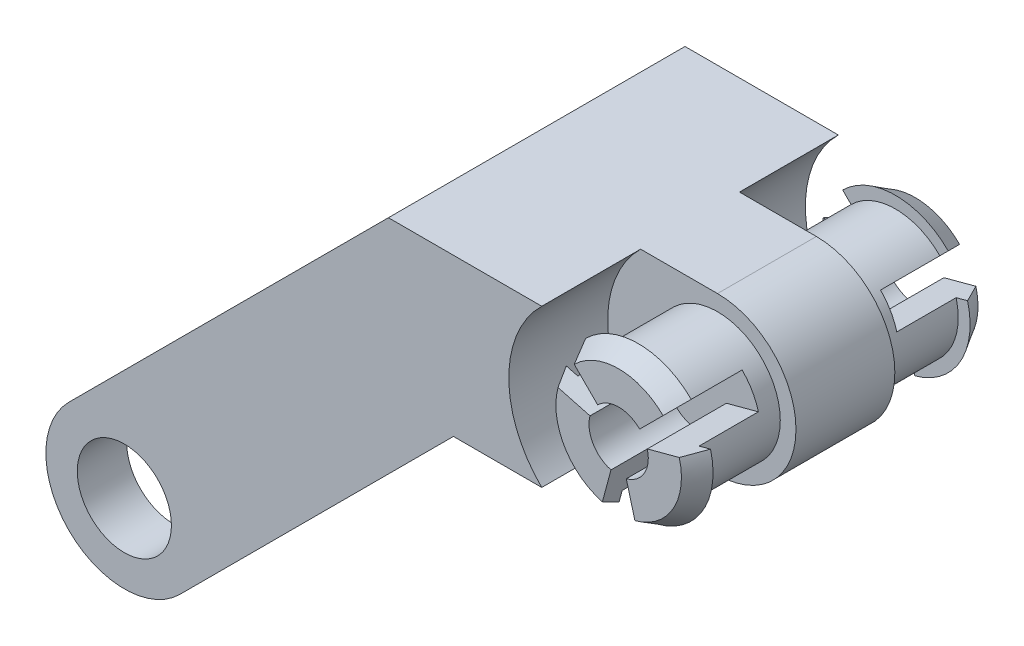
from build123d import *

# Parameters (mm, degrees)
SALIENTE_EXTRUIR1_DEPTH = 7.5
CROQUIS2_W              = 2.5
CROQUIS2_H              = 3.96875
CORTAR_EXTRUIR1_DEPTH   = 15
CROQUIS4_R              = 2.38125
CORTAR_EXTRUIR2_DEPTH   = 15
CROQUIS5_R              = 5.55625
CORTAR_EXTRUIR3_DEPTH   = 5
CORTAR_EXTRUIR6_DEPTH   = 4


with BuildPart() as part:
    # Croquis1 → Saliente-Extruir1 (new, symmetric)
    with BuildSketch(Plane.XY):
        with BuildLine():
            Line((13.356089924, 18.96875), (-2.806330038, 2.806330038))
            ThreePointArc((-2.806330038, 2.806330038), (-2.806330038, -2.806330038), (2.806330038, -2.806330038))
            Line((2.806330038, -2.806330038), (16.643910076, 11.03125))
            Line((16.643910076, 11.03125), (25, 11.03125))
            ThreePointArc((25, 11.03125), (28.96875, 15), (25, 18.96875))
            Line((25, 18.96875), (13.356089924, 18.96875))
        make_face()
    extrude(amount=SALIENTE_EXTRUIR1_DEPTH, both=True)

    # Croquis2 → Cortar-Extruir1 (cut)
    with BuildSketch(Plane(origin=(-2.806330038, 2.806330038, 0), x_dir=(0, 0, 1), z_dir=(-0.7071067811865441, 0.7071067811865509, 0))):
        with Locations((-3.75, -1.984375)):
            Rectangle(CROQUIS2_W, CROQUIS2_H)
        with Locations((3.75, -1.984375)):
            Rectangle(CROQUIS2_W, CROQUIS2_H)
    extrude(amount=-CORTAR_EXTRUIR1_DEPTH, mode=Mode.SUBTRACT)

    # Croquis4 → Cortar-Extruir2 (cut)
    with BuildSketch(Plane.XY.offset(7.5)):
        Circle(CROQUIS4_R)
    extrude(amount=-CORTAR_EXTRUIR2_DEPTH, mode=Mode.SUBTRACT)

    # Croquis5 → Cortar-Extruir3 (cut)
    with BuildSketch(Plane.XY.offset(7.5)):
        with Locations((25, 15)):
            Circle(CROQUIS5_R)
    cortar_extruir3 = extrude(amount=-CORTAR_EXTRUIR3_DEPTH, mode=Mode.SUBTRACT)

    # Simetría1: Cortar-Extruir3 across plane
    add(cortar_extruir3.mirror(Plane.XY), mode=Mode.SUBTRACT)

    # Croquis8 → Revolución1 (revolve)
    with BuildSketch(Plane(origin=(25, 0, 0), x_dir=(0, 0, -1), z_dir=(1, 0, 0))):
        Polygon((2.5, 18.175), (2.5, 15), (3.5, 15), (3.5, 16.5), (7.5, 16.5), (7.5, 18.175), (6.5, 18.775), (6.5, 18.175), align=None)
    revoluci_n1 = revolve(axis=Axis((25, 15, -2.5), (0, 0, -1)))

    # Croquis9 → Cortar-Extruir6 (cut)
    with BuildSketch(Plane(origin=(0, 0, -7.5), x_dir=(-1, 0, 0), z_dir=(0, 0, -1))):
        with BuildLine():
            Line((-23.76413906, 10.387704179), (-25, 15))
            Line((-25, 15), (-26.23586094, 10.387704179))
            ThreePointArc((-26.23586094, 10.387704179), (-25, 10.225), (-23.76413906, 10.387704179))
        make_face()
        with BuildLine():
            Line((-29.612295821, 16.23586094), (-25, 15))
            Line((-25, 15), (-28.37643488, 18.37643488))
            ThreePointArc((-28.37643488, 18.37643488), (-29.135271303, 17.3875), (-29.612295821, 16.23586094))
        make_face()
        with BuildLine():
            Line((-21.62356512, 18.37643488), (-25, 15))
            Line((-25, 15), (-20.387704179, 16.23586094))
            ThreePointArc((-20.387704179, 16.23586094), (-20.864728697, 17.3875), (-21.62356512, 18.37643488))
        make_face()
    cortar_extruir6 = extrude(amount=-CORTAR_EXTRUIR6_DEPTH, mode=Mode.SUBTRACT)

    # Simetría2: Revolución1, Cortar-Extruir6 across plane
    add(revoluci_n1.mirror(Plane.XY))
    add(cortar_extruir6.mirror(Plane.XY), mode=Mode.SUBTRACT)


solid = part.part
